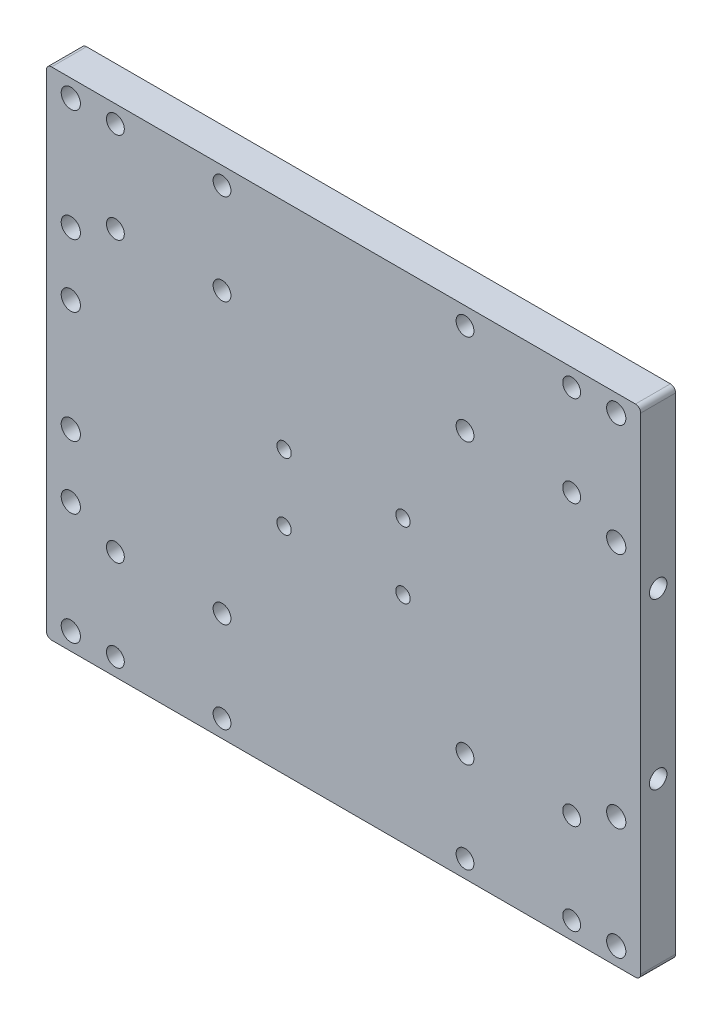
from build123d import *

# Parameters (mm, degrees)
SKETCH1_W           = 170
SKETCH1_H           = 142
BOSS_EXTRUDE1_DEPTH = 5
SKETCH2_R           = 2.55
CUT_EXTRUDE1_DEPTH  = 112.202517957
SKETCH3_R           = 2.75
CUT_EXTRUDE2_DEPTH  = 112.202517957
SKETCH4_R           = 2.05
CUT_EXTRUDE3_DEPTH  = 112.202517957
SKETCH5_R           = 2.5
CUT_EXTRUDE4_DEPTH  = 10
SKETCH6_R           = 2.75
CUT_EXTRUDE5_DEPTH  = 112.202517957
FILLET1_R           = 1.5


with BuildPart() as part:
    # Sketch1 → Boss-Extrude1 (new, symmetric)
    with BuildSketch(Plane.XY):
        Rectangle(SKETCH1_W, SKETCH1_H)
    extrude(amount=BOSS_EXTRUDE1_DEPTH, both=True)

    # Sketch2 → Cut-Extrude1 (cut, through all)
    with BuildSketch(Plane.XY.offset(5)):
        with Locations((-65.25, 66)):
            Circle(SKETCH2_R)
        with Locations((-34.75, 66)):
            Circle(SKETCH2_R)
        with Locations((-34.75, 40)):
            Circle(SKETCH2_R)
        with Locations((-65.25, 40)):
            Circle(SKETCH2_R)
        with Locations((65.25, 66)):
            Circle(SKETCH2_R)
        with Locations((65.25, 40)):
            Circle(SKETCH2_R)
        with Locations((34.75, 40)):
            Circle(SKETCH2_R)
        with Locations((34.75, 66)):
            Circle(SKETCH2_R)
        with Locations((-65.25, -40)):
            Circle(SKETCH2_R)
        with Locations((-34.75, -40)):
            Circle(SKETCH2_R)
        with Locations((-34.75, -66)):
            Circle(SKETCH2_R)
        with Locations((-65.25, -66)):
            Circle(SKETCH2_R)
        with Locations((34.75, -40)):
            Circle(SKETCH2_R)
        with Locations((65.25, -40)):
            Circle(SKETCH2_R)
        with Locations((65.25, -66)):
            Circle(SKETCH2_R)
        with Locations((34.75, -66)):
            Circle(SKETCH2_R)
    extrude(amount=-CUT_EXTRUDE1_DEPTH, mode=Mode.SUBTRACT)

    # Sketch3 → Cut-Extrude2 (cut, through all)
    with BuildSketch(Plane.XY.offset(5)):
        with Locations((-78, 66)):
            Circle(SKETCH3_R)
        with Locations((-78, 34)):
            Circle(SKETCH3_R)
        with Locations((-78, -34)):
            Circle(SKETCH3_R)
        with Locations((-78, -66)):
            Circle(SKETCH3_R)
        with Locations((78, 66)):
            Circle(SKETCH3_R)
        with Locations((78, 34)):
            Circle(SKETCH3_R)
        with Locations((78, -34)):
            Circle(SKETCH3_R)
        with Locations((78, -66)):
            Circle(SKETCH3_R)
    extrude(amount=-CUT_EXTRUDE2_DEPTH, mode=Mode.SUBTRACT)

    # Sketch4 → Cut-Extrude3 (cut, through all)
    with BuildSketch(Plane.XY.offset(5)):
        with Locations((-17, 9.5)):
            Circle(SKETCH4_R)
        with Locations((-17, -9.5)):
            Circle(SKETCH4_R)
        with Locations((17, -9.5)):
            Circle(SKETCH4_R)
        with Locations((17, 9.5)):
            Circle(SKETCH4_R)
    extrude(amount=-CUT_EXTRUDE3_DEPTH, mode=Mode.SUBTRACT)

    # Sketch5 → Cut-Extrude4 (cut)
    with BuildSketch(Plane(origin=(85, 0, 0), x_dir=(0, 0, -1), z_dir=(1, 0, 0))):
        with Locations((0, 23.6)):
            Circle(SKETCH5_R)
        with Locations((0, -23.6)):
            Circle(SKETCH5_R)
    extrude(amount=-CUT_EXTRUDE4_DEPTH, mode=Mode.SUBTRACT)

    # Sketch6 → Cut-Extrude5 (cut, through all)
    with BuildSketch(Plane.XY.offset(5)):
        with Locations((-78, 16)):
            Circle(SKETCH6_R)
        with Locations((-78, -16)):
            Circle(SKETCH6_R)
    extrude(amount=-CUT_EXTRUDE5_DEPTH, mode=Mode.SUBTRACT)

    # Fillet1
    fillet1_edges = [part.edges().sort_by_distance(p)[0] for p in [
        (-85, -71, 0),
        (85, -71, 0),
        (85, 71, 0),
        (-85, 71, 0),
    ]]
    fillet(fillet1_edges, radius=FILLET1_R)


solid = part.part
